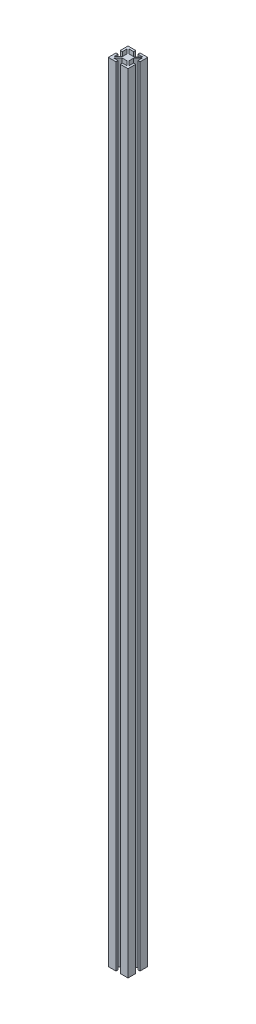
from build123d import *

# Parameters (mm, degrees)
EXTRUDE1_DEPTH = 1524


# Read off the part's stored shape, not the designer's step: 1515<1>
with BuildPart() as part:
    # Sketch1<2> → Extrude1 (new body)
    with BuildSketch(Plane(origin=(0, 0, 0), x_dir=(1, 0, 0), z_dir=(0, 1, 0))):
        Polygon((-6.7564, 4.364749804), (-6.7564, -4.364749804), (-14.986, -12.594349804), (-14.986, -4.064), (-19.05, -4.064), (-19.05, -19.05), (-4.064, -19.05), (-4.064, -14.986), (-13.067127258, -14.986), (-4.837527258, -6.7564), (4.837527258, -6.7564), (13.067127258, -14.986), (4.064, -14.986), (4.064, -19.05), (19.05, -19.05), (19.05, -4.064), (14.986, -4.064), (14.986, -12.594349804), (6.7564, -4.364749804), (6.7564, 4.364749804), (14.986, 12.594349804), (14.986, 4.064), (19.05, 4.064), (19.05, 19.05), (4.064, 19.05), (4.064, 14.986), (13.067127258, 14.986), (4.837527258, 6.7564), (-4.837527258, 6.7564), (-13.067127258, 14.986), (-4.064, 14.986), (-4.064, 19.05), (-19.05, 19.05), (-19.05, 4.064), (-14.986, 4.064), (-14.986, 12.594349804), align=None)
    extrude(amount=EXTRUDE1_DEPTH)


solid = part.part
